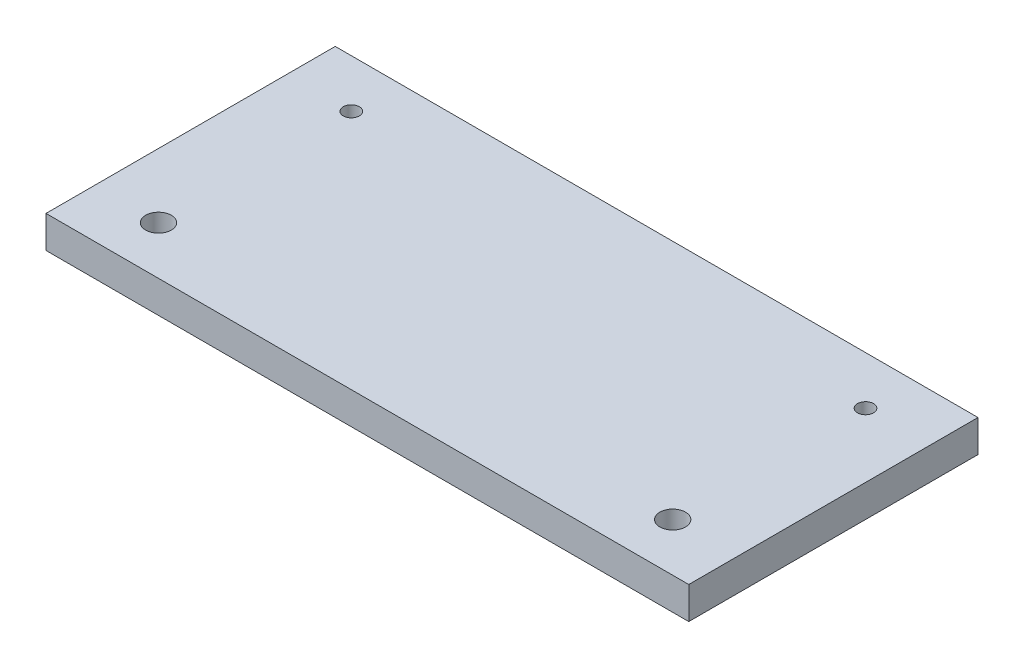
from build123d import *

# Parameters (mm, degrees)
SKETCH1_W           = 200
SKETCH1_H           = 90
BOSS_EXTRUDE1_DEPTH = 10
SKETCH2_R           = 4
CUT_EXTRUDE1_DEPTH  = 10
SKETCH4_R           = 2.5
CUT_EXTRUDE2_DEPTH  = 10


with BuildPart() as part:
    # Sketch1 → Boss-Extrude1 (new body)
    with BuildSketch(Plane(origin=(0, 0, 0), x_dir=(1, 0, 0), z_dir=(0, 1, 0))):
        Rectangle(SKETCH1_W, SKETCH1_H)
    extrude(amount=BOSS_EXTRUDE1_DEPTH)

    # Sketch2 → Cut-Extrude1 (cut)
    with BuildSketch(Plane(origin=(0, 10, 0), x_dir=(1, 0, 0), z_dir=(0, 1, 0))):
        with Locations((-80, -30)):
            Circle(SKETCH2_R)
        with Locations((80, -30)):
            Circle(SKETCH2_R)
    extrude(amount=-CUT_EXTRUDE1_DEPTH, mode=Mode.SUBTRACT)

    # Sketch4 → Cut-Extrude2 (cut)
    with BuildSketch(Plane(origin=(0, 10, 0), x_dir=(1, 0, 0), z_dir=(0, 1, 0))):
        with Locations((-80, 30)):
            Circle(SKETCH4_R)
        with Locations((80, 30)):
            Circle(SKETCH4_R)
    extrude(amount=-CUT_EXTRUDE2_DEPTH, mode=Mode.SUBTRACT)


solid = part.part
